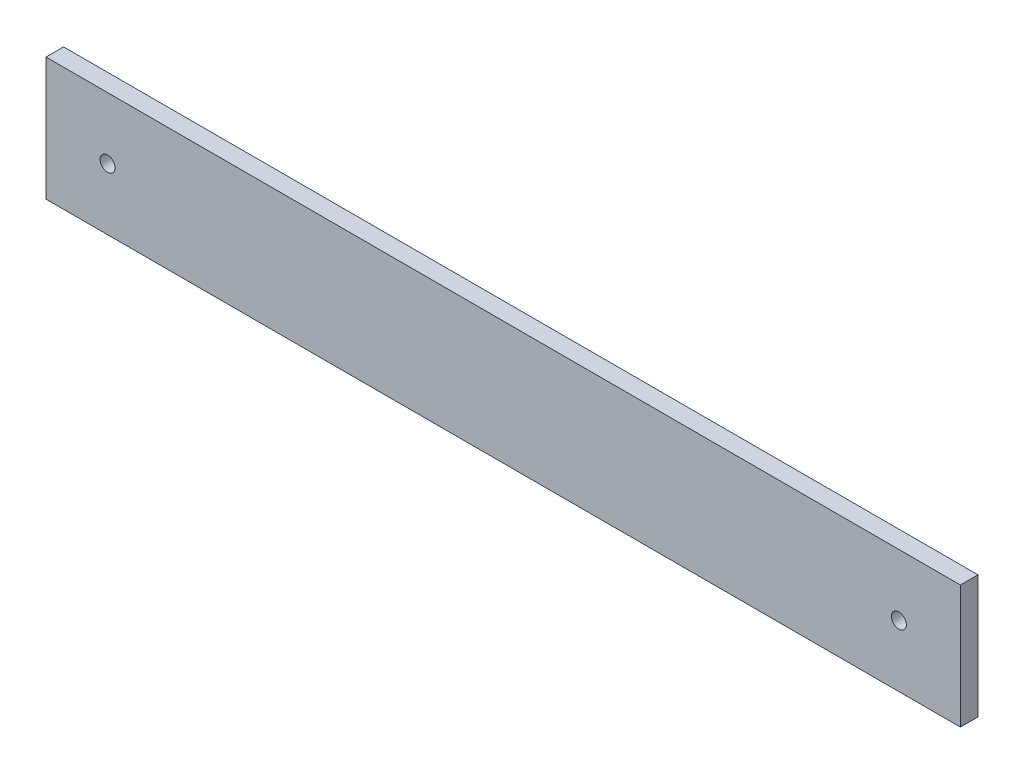
from build123d import *

# Parameters (mm, degrees)
SKETCH_1_W      = 208
SKETCH_1_H      = 28
SKETCH_1_R      = 1.7
EXTRUDE_1_DEPTH = 2


with BuildPart() as part:
    # 草图1 → 凸台-拉伸1 (new, symmetric)
    with BuildSketch(Plane.XY):
        with Locations((90, 0)):
            Rectangle(SKETCH_1_W, SKETCH_1_H)
        Circle(SKETCH_1_R, mode=Mode.SUBTRACT)
        with Locations((180, 0)):
            Circle(SKETCH_1_R, mode=Mode.SUBTRACT)
    extrude(amount=EXTRUDE_1_DEPTH, both=True)


solid = part.part
